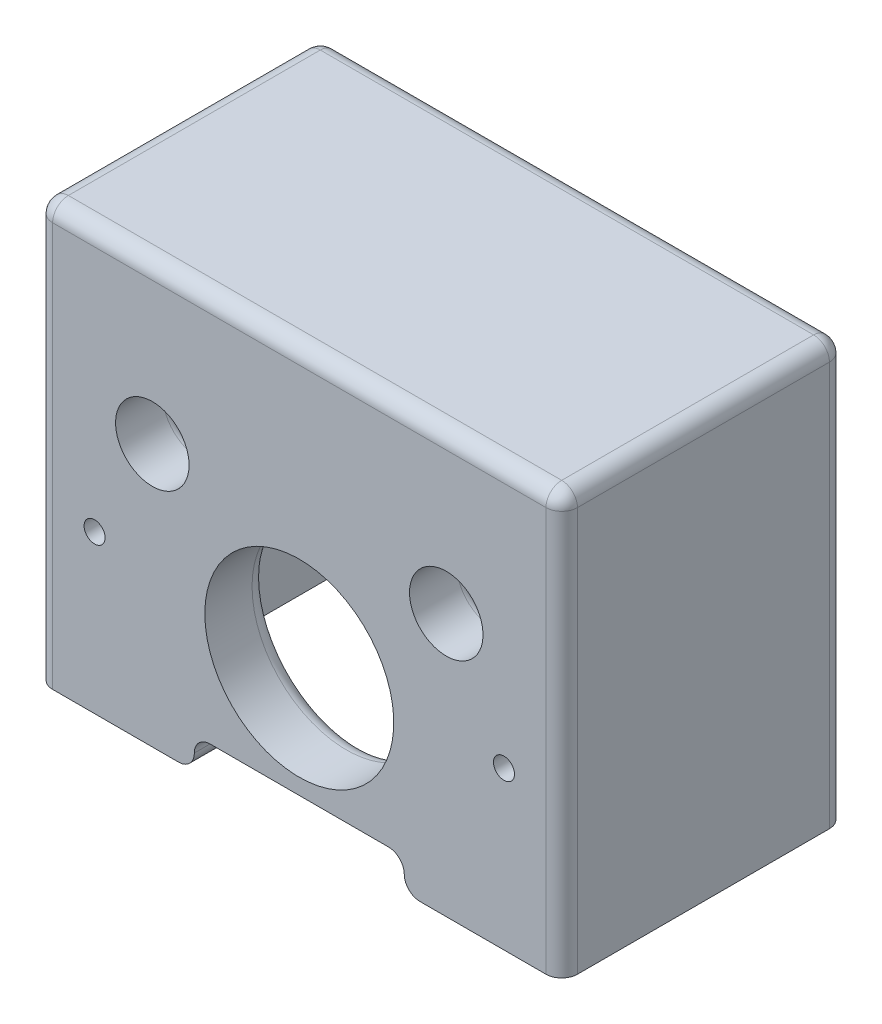
from build123d import *

# Parameters (mm, degrees)
SKETCH1_W           = 50
SKETCH1_H           = 40
BOSS_EXTRUDE1_DEPTH = 27
SKETCH2_W           = 39
SKETCH2_H           = 35
CUT_EXTRUDE1_DEPTH  = 21
SKETCH3_R           = 9
SKETCH3_R_2         = 3.5
SKETCH3_W           = 20
SKETCH3_H           = 3
CUT_EXTRUDE2_DEPTH  = 68.386942355
SKETCH4_R           = 1
CUT_EXTRUDE3_DEPTH  = 6
FILLET1_R           = 1.5


with BuildPart() as part:
    # Sketch1 → Boss-Extrude1 (new body)
    with BuildSketch(Plane.XY):
        with Locations((25, 20)):
            Rectangle(SKETCH1_W, SKETCH1_H)
    extrude(amount=BOSS_EXTRUDE1_DEPTH)

    # Sketch2 → Cut-Extrude1 (cut)
    with BuildSketch(Plane(origin=(0, 0, 0), x_dir=(-1, 0, 0), z_dir=(0, 0, -1))):
        with Locations((-25, 17.5)):
            Rectangle(SKETCH2_W, SKETCH2_H)
    extrude(amount=-CUT_EXTRUDE1_DEPTH, mode=Mode.SUBTRACT)

    # Sketch3 → Cut-Extrude2 (cut, through all)
    with BuildSketch(Plane(origin=(0, 0, 21), x_dir=(-1, 0, 0), z_dir=(0, 0, -1))):
        with Locations((-25, 13.5)):
            Circle(SKETCH3_R)
        with Locations((-39, 25)):
            Circle(SKETCH3_R_2)
        with Locations(Location((-11, 25, 0), (0, 0, 180))):
            Circle(SKETCH3_R_2)
        with Locations((-25, 1.5)):
            Rectangle(SKETCH3_W, SKETCH3_H)
    extrude(amount=-CUT_EXTRUDE2_DEPTH, mode=Mode.SUBTRACT)

    # Sketch4 → Cut-Extrude3 (cut)
    with BuildSketch(Plane.XY.offset(27)):
        with Locations((44.5, 15)):
            Circle(SKETCH4_R)
        with Locations(Location((5.5, 15, 0), (0, 0, 90))):
            Circle(SKETCH4_R)
    extrude(amount=-CUT_EXTRUDE3_DEPTH, mode=Mode.SUBTRACT)

    # Fillet1
    # the kernel refuses this fillet: 1.5 mm, written as the material it adds along each edge
    with BuildSketch(Plane(origin=(15, 3, 21), x_dir=(0, -1, 0), z_dir=(0, 0, 1)), Plane(origin=(35, 3, 21), x_dir=(-1, 0, 0), z_dir=(0, 0, 1))) as fillet1_piece_1:
        with BuildLine():
            CenterArc((FILLET1_R, FILLET1_R), FILLET1_R, 180, 90)
            Line((0, FILLET1_R), (0, 0))
            Line((0, 0), (FILLET1_R, 0))
        make_face()
    extrude(amount=6)
    # the kernel refuses this fillet: 1.5 mm, written as the material it takes off along each edge
    with BuildSketch(Plane(origin=(48.5, 38.5, 1.5), x_dir=(0, 0, -1), z_dir=(1, 0, 0))) as fillet1_2_piece_1_section:
        Polygon((0, 0), (FILLET1_R, 0), (FILLET1_R, FILLET1_R), (0, FILLET1_R), align=None)
    fillet1_2_piece_1 = extrude(amount=FILLET1_R, mode=Mode.PRIVATE)
    fillet1_2_piece_1 = fillet1_2_piece_1 - Plane(origin=(48.5, 38.5, 1.5), x_dir=(0, -0.7071067811865475, 0.7071067811865475), z_dir=(1, 0, 0)) * Sphere(FILLET1_R, mode=Mode.PRIVATE)
    add(fillet1_2_piece_1, mode=Mode.SUBTRACT)
    with BuildSketch(Plane(origin=(1.5, 38.5, 1.5), x_dir=(-1, 0, 0), z_dir=(0, 0, -1))) as fillet1_2_piece_2_section:
        Polygon((0, 0), (FILLET1_R, 0), (FILLET1_R, FILLET1_R), (0, FILLET1_R), align=None)
    fillet1_2_piece_2 = extrude(amount=FILLET1_R, mode=Mode.PRIVATE)
    fillet1_2_piece_2 = fillet1_2_piece_2 - Plane(origin=(1.5, 38.5, 1.5), x_dir=(0.7071067811865475, -0.7071067811865475, 0), z_dir=(0, 0, -1)) * Sphere(FILLET1_R, mode=Mode.PRIVATE)
    add(fillet1_2_piece_2, mode=Mode.SUBTRACT)
    with BuildSketch(Plane(origin=(1.5, 38.5, 25.5), x_dir=(-1, 0, 0), z_dir=(0, 0, 1))) as fillet1_2_piece_3_section:
        Polygon((0, 0), (FILLET1_R, 0), (FILLET1_R, -FILLET1_R), (0, -FILLET1_R), align=None)
    fillet1_2_piece_3 = extrude(amount=FILLET1_R, mode=Mode.PRIVATE)
    fillet1_2_piece_3 = fillet1_2_piece_3 - Plane(origin=(1.5, 38.5, 25.5), x_dir=(0.7071067811865475, -0.7071067811865475, 0), z_dir=(0, 0, 1)) * Sphere(FILLET1_R, mode=Mode.PRIVATE)
    add(fillet1_2_piece_3, mode=Mode.SUBTRACT)
    with BuildSketch(Plane(origin=(48.5, 38.5, 25.5), x_dir=(0, 0, 1), z_dir=(1, 0, 0))) as fillet1_2_piece_4_section:
        Polygon((0, 0), (FILLET1_R, 0), (FILLET1_R, -FILLET1_R), (0, -FILLET1_R), align=None)
    fillet1_2_piece_4 = extrude(amount=FILLET1_R, mode=Mode.PRIVATE)
    fillet1_2_piece_4 = fillet1_2_piece_4 - Plane(origin=(48.5, 38.5, 25.5), x_dir=(0, -0.7071067811865475, -0.7071067811865475), z_dir=(1, 0, 0)) * Sphere(FILLET1_R, mode=Mode.PRIVATE)
    add(fillet1_2_piece_4, mode=Mode.SUBTRACT)
    with BuildSketch(Plane(origin=(15, 0, 17.25), x_dir=(-1, 0, 0), z_dir=(0, 0, 1))) as fillet1_2_piece_5:
        with BuildLine():
            CenterArc((FILLET1_R, -FILLET1_R), FILLET1_R, 90, 90)
            Line((0, -FILLET1_R), (0, 0))
            Line((0, 0), (FILLET1_R, 0))
        make_face()
    extrude(amount=13.5, mode=Mode.SUBTRACT)
    with BuildSketch(Plane(origin=(35, 0, 17.25), x_dir=(1, 0, 0), z_dir=(0, 0, 1))) as fillet1_2_piece_6:
        with BuildLine():
            CenterArc((FILLET1_R, FILLET1_R), FILLET1_R, 180, 90)
            Line((0, FILLET1_R), (0, 0))
            Line((0, 0), (FILLET1_R, 0))
        make_face()
    extrude(amount=13.5, mode=Mode.SUBTRACT)
    with BuildSketch(Plane(origin=(15, -3.75, 21), x_dir=(-1, 0, 0), z_dir=(0, 1, 0)), Plane(origin=(35, 1.5, 21), x_dir=(1, 0, 0), z_dir=(0, -1, 0))) as fillet1_2_piece_7:
        with BuildLine():
            CenterArc((FILLET1_R, FILLET1_R), FILLET1_R, 180, 90)
            Line((0, FILLET1_R), (0, 0))
            Line((0, 0), (FILLET1_R, 0))
        make_face()
    extrude(amount=5.25, mode=Mode.SUBTRACT)
    with BuildSketch(Plane(origin=(16.5, 3, 21), x_dir=(0, 1, 0), z_dir=(1, 0, 0))) as fillet1_2_piece_8:
        with BuildLine():
            CenterArc((FILLET1_R, FILLET1_R), FILLET1_R, 180, 90)
            Line((0, FILLET1_R), (0, 0))
            Line((0, 0), (FILLET1_R, 0))
        make_face()
    extrude(amount=17, mode=Mode.SUBTRACT)
    with BuildSketch(Plane(origin=(39, 25, 21), x_dir=(-1, 0, 0), z_dir=(0, -1, 0))) as fillet1_2_piece_9:
        with BuildLine():
            CenterArc((3.5 + FILLET1_R, -FILLET1_R), FILLET1_R, 90, 90)
            Line((3.5, -FILLET1_R), (3.5, 0))
            Line((3.5, 0), (3.5 + FILLET1_R, 0))
        make_face()
    revolve(axis=Axis((39, 25, 21), (0, 0, -1)), mode=Mode.SUBTRACT)
    with BuildSketch(Plane(origin=(11, 25, 21), x_dir=(1, 0, 0), z_dir=(0, 1, 0))) as fillet1_2_piece_10:
        with BuildLine():
            CenterArc((3.5 + FILLET1_R, -FILLET1_R), FILLET1_R, 90, 90)
            Line((3.5, -FILLET1_R), (3.5, 0))
            Line((3.5, 0), (3.5 + FILLET1_R, 0))
        make_face()
    revolve(axis=Axis((11, 25, 21), (0, 0, -1)), mode=Mode.SUBTRACT)
    with BuildSketch(Plane(origin=(25, 13.5, 21), x_dir=(-1, 0, 0), z_dir=(0, -1, 0))) as fillet1_2_piece_11:
        with BuildLine():
            CenterArc((9 + FILLET1_R, -FILLET1_R), FILLET1_R, 90, 90)
            Line((9, -FILLET1_R), (9, 0))
            Line((9, 0), (9 + FILLET1_R, 0))
        make_face()
    revolve(axis=Axis((25, 13.5, 21), (0, 0, -1)), mode=Mode.SUBTRACT)
    with BuildSketch(Plane(origin=(5.5, -3.75, 0), x_dir=(-1, 0, 0), z_dir=(0, 1, 0)), Plane(origin=(44.5, 35, 0), x_dir=(1, 0, 0), z_dir=(0, -1, 0))) as fillet1_2_piece_12:
        with BuildLine():
            CenterArc((FILLET1_R, FILLET1_R), FILLET1_R, 180, 90)
            Line((0, FILLET1_R), (0, 0))
            Line((0, 0), (FILLET1_R, 0))
        make_face()
    extrude(amount=38.75, mode=Mode.SUBTRACT)
    with BuildSketch(Plane(origin=(5.5, 35, 0), x_dir=(0, 1, 0), z_dir=(1, 0, 0))) as fillet1_2_piece_13:
        with BuildLine():
            CenterArc((FILLET1_R, FILLET1_R), FILLET1_R, 180, 90)
            Line((0, FILLET1_R), (0, 0))
            Line((0, 0), (FILLET1_R, 0))
        make_face()
    extrude(amount=39, mode=Mode.SUBTRACT)
    with BuildSketch(Plane(origin=(50, -3.75, 0), x_dir=(-1, 0, 0), z_dir=(0, 1, 0)), Plane(origin=(0, 38.5, 0), x_dir=(1, 0, 0), z_dir=(0, -1, 0))) as fillet1_2_piece_14:
        with BuildLine():
            CenterArc((FILLET1_R, FILLET1_R), FILLET1_R, 180, 90)
            Line((0, FILLET1_R), (0, 0))
            Line((0, 0), (FILLET1_R, 0))
        make_face()
    extrude(amount=42.25, mode=Mode.SUBTRACT)
    with BuildSketch(Plane(origin=(48.5, 40, 0), x_dir=(0, -1, 0), z_dir=(-1, 0, 0))) as fillet1_2_piece_15:
        with BuildLine():
            CenterArc((FILLET1_R, FILLET1_R), FILLET1_R, 180, 90)
            Line((0, FILLET1_R), (0, 0))
            Line((0, 0), (FILLET1_R, 0))
        make_face()
    extrude(amount=47, mode=Mode.SUBTRACT)
    with BuildSketch(Plane(origin=(0, 40, 1.5), x_dir=(0, -1, 0), z_dir=(0, 0, 1)), Plane(origin=(50, 40, 1.5), x_dir=(-1, 0, 0), z_dir=(0, 0, 1))) as fillet1_2_piece_16:
        with BuildLine():
            CenterArc((FILLET1_R, FILLET1_R), FILLET1_R, 180, 90)
            Line((0, FILLET1_R), (0, 0))
            Line((0, 0), (FILLET1_R, 0))
        make_face()
    extrude(amount=24, mode=Mode.SUBTRACT)
    with BuildSketch(Plane(origin=(0, 38.5, 27), x_dir=(1, 0, 0), z_dir=(0, -1, 0)), Plane(origin=(50, -3.75, 27), x_dir=(-1, 0, 0), z_dir=(0, 1, 0))) as fillet1_2_piece_17:
        with BuildLine():
            CenterArc((FILLET1_R, -FILLET1_R), FILLET1_R, 90, 90)
            Line((0, -FILLET1_R), (0, 0))
            Line((0, 0), (FILLET1_R, 0))
        make_face()
    extrude(amount=42.25, mode=Mode.SUBTRACT)
    with BuildSketch(Plane(origin=(48.5, 40, 27), x_dir=(0, -1, 0), z_dir=(-1, 0, 0))) as fillet1_2_piece_18:
        with BuildLine():
            CenterArc((FILLET1_R, -FILLET1_R), FILLET1_R, 90, 90)
            Line((0, -FILLET1_R), (0, 0))
            Line((0, 0), (FILLET1_R, 0))
        make_face()
    extrude(amount=47, mode=Mode.SUBTRACT)
    with BuildSketch(Plane(origin=(16.5, 1.5, 21), x_dir=(-1, 0, 0), z_dir=(0, -1, 0))) as fillet1_2_piece_19:
        with BuildLine():
            CenterArc((1.5 + FILLET1_R, -FILLET1_R), FILLET1_R, 90, 90)
            Line((1.5, -FILLET1_R), (1.5, 0))
            Line((1.5, 0), (1.5 + FILLET1_R, 0))
        make_face()
    revolve(axis=Axis((16.5, 1.5, 21), (0, 0, -1)), revolution_arc=90, mode=Mode.SUBTRACT)
    with BuildSketch(Plane(origin=(33.5, 1.5, 21), x_dir=(0, 1, 0), z_dir=(-1, 0, 0))) as fillet1_2_piece_20:
        with BuildLine():
            CenterArc((1.5 + FILLET1_R, -FILLET1_R), FILLET1_R, 90, 90)
            Line((1.5, -FILLET1_R), (1.5, 0))
            Line((1.5, 0), (1.5 + FILLET1_R, 0))
        make_face()
    revolve(axis=Axis((33.5, 1.5, 21), (0, 0, -1)), revolution_arc=90, mode=Mode.SUBTRACT)
    with BuildSketch(Plane(origin=(1.75, 35, 0), x_dir=(0, 1, 0), z_dir=(1, 0, 0))) as fillet1_2_piece_21a_section:
        with BuildLine():
            CenterArc((FILLET1_R, FILLET1_R), FILLET1_R, 180, 90)
            Line((0, FILLET1_R), (0, 0))
            Line((0, 0), (FILLET1_R, 0))
        make_face()
    fillet1_2_piece_21a = extrude(amount=42.75, mode=Mode.PRIVATE)
    fillet1_2_piece_21a = split(fillet1_2_piece_21a, bisect_by=Plane(origin=(5.5, 35.339592671, 0.339592671), z_dir=(-1, 0, 0)), keep=Keep.TOP, mode=Mode.PRIVATE)
    with BuildSketch(Plane(origin=(5.5, -3.75, 0), x_dir=(-1, 0, 0), z_dir=(0, 1, 0))) as fillet1_2_piece_21b_section:
        with BuildLine():
            CenterArc((FILLET1_R, FILLET1_R), FILLET1_R, 180, 90)
            Line((0, FILLET1_R), (0, 0))
            Line((0, 0), (FILLET1_R, 0))
        make_face()
    fillet1_2_piece_21b = extrude(amount=42.5, mode=Mode.PRIVATE)
    fillet1_2_piece_21b = split(fillet1_2_piece_21b, bisect_by=Plane(origin=(5.160407329, 35, 0.339592671), z_dir=(0, 1, 0)), keep=Keep.TOP, mode=Mode.PRIVATE)
    fillet1_2_piece_21 = fillet1_2_piece_21a & fillet1_2_piece_21b
    add(fillet1_2_piece_21, mode=Mode.SUBTRACT)
    with BuildSketch(Plane(origin=(44.5, 38.75, 0), x_dir=(1, 0, 0), z_dir=(0, -1, 0))) as fillet1_2_piece_22a_section:
        with BuildLine():
            CenterArc((FILLET1_R, FILLET1_R), FILLET1_R, 180, 90)
            Line((0, FILLET1_R), (0, 0))
            Line((0, 0), (FILLET1_R, 0))
        make_face()
    fillet1_2_piece_22a = extrude(amount=42.5, mode=Mode.PRIVATE)
    fillet1_2_piece_22a = split(fillet1_2_piece_22a, bisect_by=Plane(origin=(44.839592671, 35, 0.339592671), z_dir=(0, 1, 0)), keep=Keep.TOP, mode=Mode.PRIVATE)
    with BuildSketch(Plane(origin=(5.5, 35, 0), x_dir=(0, 1, 0), z_dir=(1, 0, 0))) as fillet1_2_piece_22b_section:
        with BuildLine():
            CenterArc((FILLET1_R, FILLET1_R), FILLET1_R, 180, 90)
            Line((0, FILLET1_R), (0, 0))
            Line((0, 0), (FILLET1_R, 0))
        make_face()
    fillet1_2_piece_22b = extrude(amount=42.75, mode=Mode.PRIVATE)
    fillet1_2_piece_22b = split(fillet1_2_piece_22b, bisect_by=Plane(origin=(44.5, 35.339592671, 0.339592671), z_dir=(1, 0, 0)), keep=Keep.TOP, mode=Mode.PRIVATE)
    fillet1_2_piece_22 = fillet1_2_piece_22a & fillet1_2_piece_22b
    add(fillet1_2_piece_22, mode=Mode.SUBTRACT)


solid = part.part
